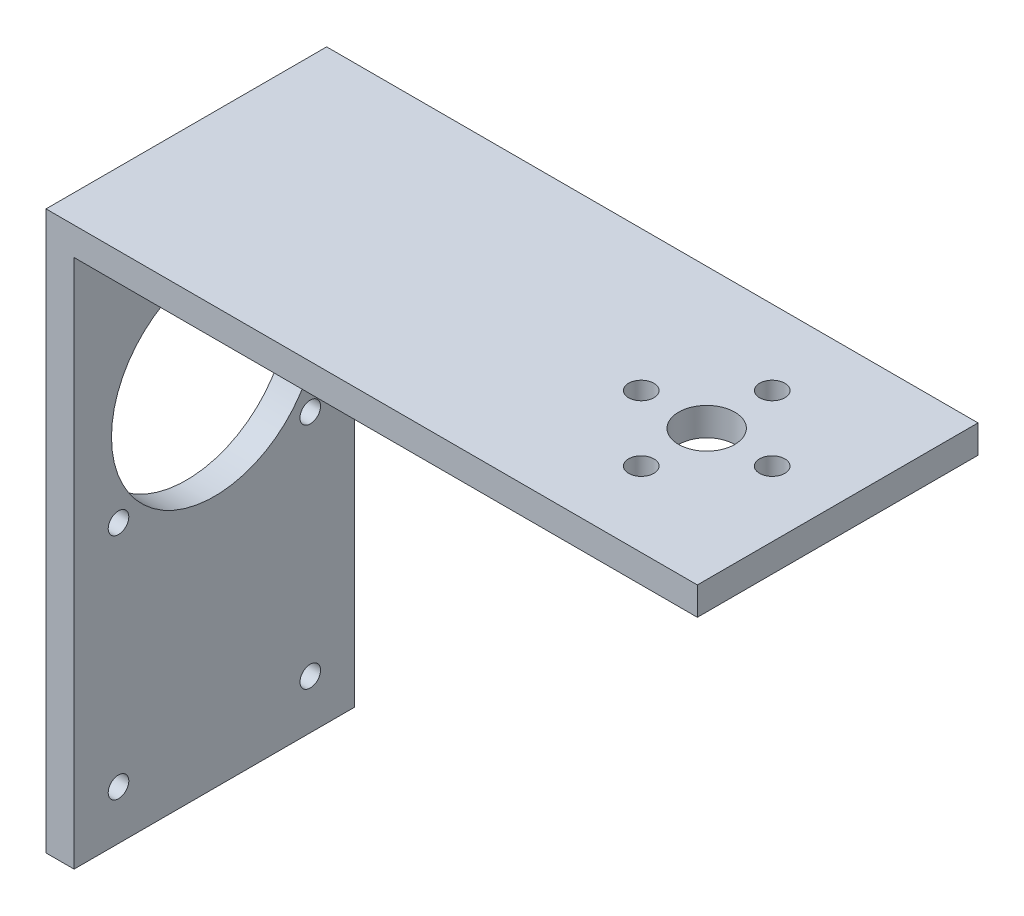
from build123d import *

# Parameters (mm, degrees)
S_BOX1_W      = 69.625
S_BOX1_H      = 3
BOSS_1_DEPTH  = 30
S_BOX2_W      = 3
S_BOX2_H      = 57.125
BOSS_2_DEPTH  = 30
S_BOX3_W      = 29.125
S_BOX3_H      = 3.5
BOSS_3_DEPTH  = 3
S_HOLE4_R     = 3
HOLE_4_DEPTH  = 3.2
S_HOLE5_R     = 1.35
HOLE_5_DEPTH  = 3.2
S_HOLE6_R     = 1.35
HOLE_6_DEPTH  = 3.2
S_HOLE7_R     = 1.35
HOLE_7_DEPTH  = 3.2
S_HOLE8_R     = 1.35
HOLE_8_DEPTH  = 3.2
S_HOLE9_R     = 11
HOLE_9_DEPTH  = 3.2
S_HOLE10_R    = 1.1
HOLE_10_DEPTH = 3.2
S_HOLE11_R    = 1.1
HOLE_11_DEPTH = 3.2
S_HOLE12_R    = 1.1
HOLE_12_DEPTH = 3.2
S_HOLE13_R    = 1.1
HOLE_13_DEPTH = 3.2


with BuildPart() as part:
    # S_box1 → Boss_1 (new body)
    with BuildSketch(Plane.XY.offset(-15)):
        with Locations((-20.8125, 20.125)):
            Rectangle(S_BOX1_W, S_BOX1_H)
    extrude(amount=BOSS_1_DEPTH)

    # S_box2 → Boss_2 (add)
    with BuildSketch(Plane.XY.offset(-15)):
        with Locations((-54.125, -9.4375)):
            Rectangle(S_BOX2_W, S_BOX2_H)
    extrude(amount=BOSS_2_DEPTH)

    # S_box3 → Boss_3 (add)
    with BuildSketch(Plane.XY.offset(-15)):
        with Locations((-38.5625, 17.375)):
            Rectangle(S_BOX3_W, S_BOX3_H)
    extrude(amount=BOSS_3_DEPTH)

    # S_hole4 → Hole_4 (cut)
    with BuildSketch(Plane(origin=(0, 18.525, 0), x_dir=(1, 0, 0), z_dir=(0, 1, 0))):
        Circle(S_HOLE4_R)
    extrude(amount=HOLE_4_DEPTH, mode=Mode.SUBTRACT)

    # S_hole5 → Hole_5 (cut)
    with BuildSketch(Plane(origin=(0, 18.525, 0), x_dir=(1, 0, 0), z_dir=(0, 1, 0))):
        with Locations((7, 0)):
            Circle(S_HOLE5_R)
    extrude(amount=HOLE_5_DEPTH, mode=Mode.SUBTRACT)

    # S_hole6 → Hole_6 (cut)
    with BuildSketch(Plane(origin=(0, 18.525, 0), x_dir=(1, 0, 0), z_dir=(0, 1, 0))):
        with Locations((0, -7)):
            Circle(S_HOLE6_R)
    extrude(amount=HOLE_6_DEPTH, mode=Mode.SUBTRACT)

    # S_hole7 → Hole_7 (cut)
    with BuildSketch(Plane(origin=(0, 18.525, 0), x_dir=(1, 0, 0), z_dir=(0, 1, 0))):
        with Locations((-7, 0)):
            Circle(S_HOLE7_R)
    extrude(amount=HOLE_7_DEPTH, mode=Mode.SUBTRACT)

    # S_hole8 → Hole_8 (cut)
    with BuildSketch(Plane(origin=(0, 18.525, 0), x_dir=(1, 0, 0), z_dir=(0, 1, 0))):
        with Locations((0, 7)):
            Circle(S_HOLE8_R)
    extrude(amount=HOLE_8_DEPTH, mode=Mode.SUBTRACT)

    # S_hole9 → Hole_9 (cut)
    with BuildSketch(Plane(origin=(-55.725, 0, 0), x_dir=(0, 0, -1), z_dir=(1, 0, 0))):
        Circle(S_HOLE9_R)
    extrude(amount=HOLE_9_DEPTH, mode=Mode.SUBTRACT)

    # S_hole10 → Hole_10 (cut)
    with BuildSketch(Plane(origin=(-55.725, 0, 0), x_dir=(0, 0, -1), z_dir=(1, 0, 0))):
        with Locations((10.25, -8.3)):
            Circle(S_HOLE10_R)
    extrude(amount=HOLE_10_DEPTH, mode=Mode.SUBTRACT)

    # S_hole11 → Hole_11 (cut)
    with BuildSketch(Plane(origin=(-55.725, 0, 0), x_dir=(0, 0, -1), z_dir=(1, 0, 0))):
        with Locations((-10.25, -8.3)):
            Circle(S_HOLE11_R)
    extrude(amount=HOLE_11_DEPTH, mode=Mode.SUBTRACT)

    # S_hole12 → Hole_12 (cut)
    with BuildSketch(Plane(origin=(-55.725, 0, 0), x_dir=(0, 0, -1), z_dir=(1, 0, 0))):
        with Locations((10.25, -32.75)):
            Circle(S_HOLE12_R)
    extrude(amount=HOLE_12_DEPTH, mode=Mode.SUBTRACT)

    # S_hole13 → Hole_13 (cut)
    with BuildSketch(Plane(origin=(-55.725, 0, 0), x_dir=(0, 0, -1), z_dir=(1, 0, 0))):
        with Locations((-10.25, -32.75)):
            Circle(S_HOLE13_R)
    extrude(amount=HOLE_13_DEPTH, mode=Mode.SUBTRACT)


solid = part.part
